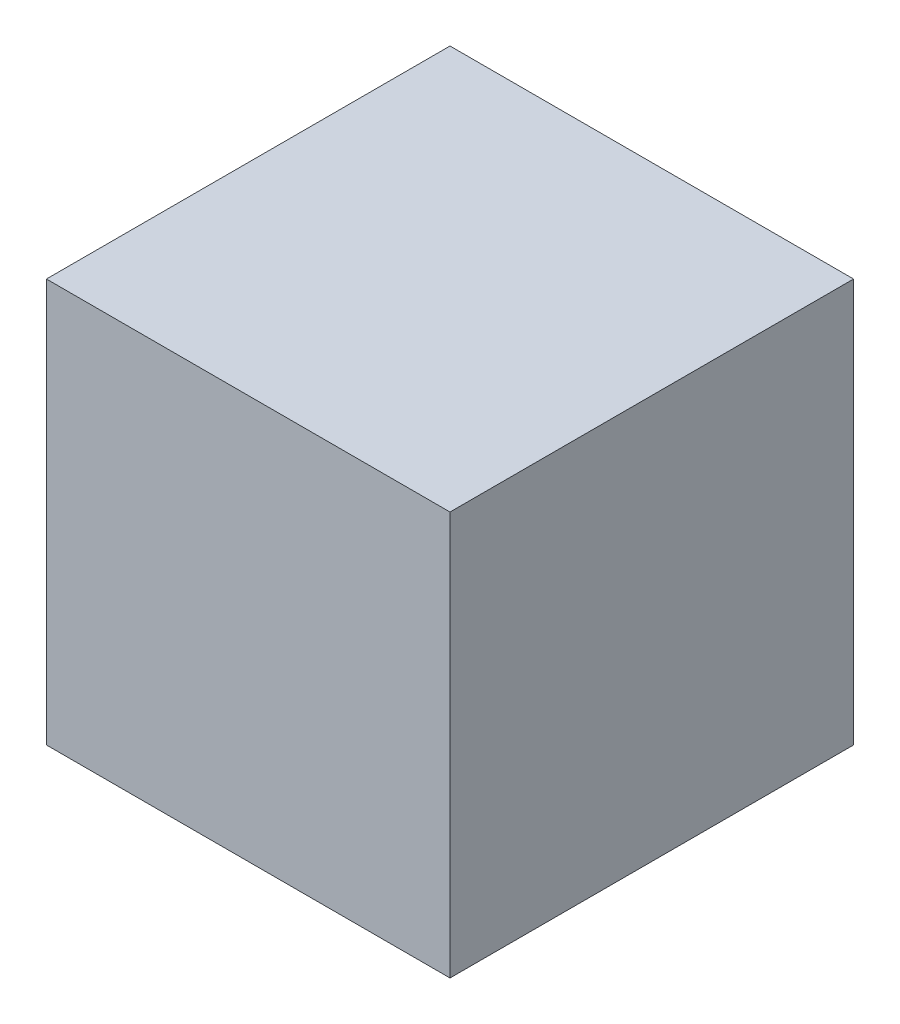
from build123d import *

# Parameters (mm, degrees)
BOSS_EXTRU_1_DEPTH      = 100
BOSS_EXTRU_1_DEPTH_BACK = 100
ESQUISSE1_W             = 200
ESQUISSE1_H             = 200
ECHELLE1_SCALE          = 0.001


with BuildPart() as part:
    # Esquisse1 → Boss.-Extru.1 (new, two sides: drawn at the far end of the back side and taken through both)
    with BuildSketch(Plane.XY.offset(-BOSS_EXTRU_1_DEPTH_BACK)):
        Rectangle(ESQUISSE1_W, ESQUISSE1_H)
    extrude(amount=BOSS_EXTRU_1_DEPTH + BOSS_EXTRU_1_DEPTH_BACK)


with BuildPart() as part_1:
    # Echelle1: scaled about (0, 0, 0)
    add(part.part.scale(ECHELLE1_SCALE))


solid = part_1.part
